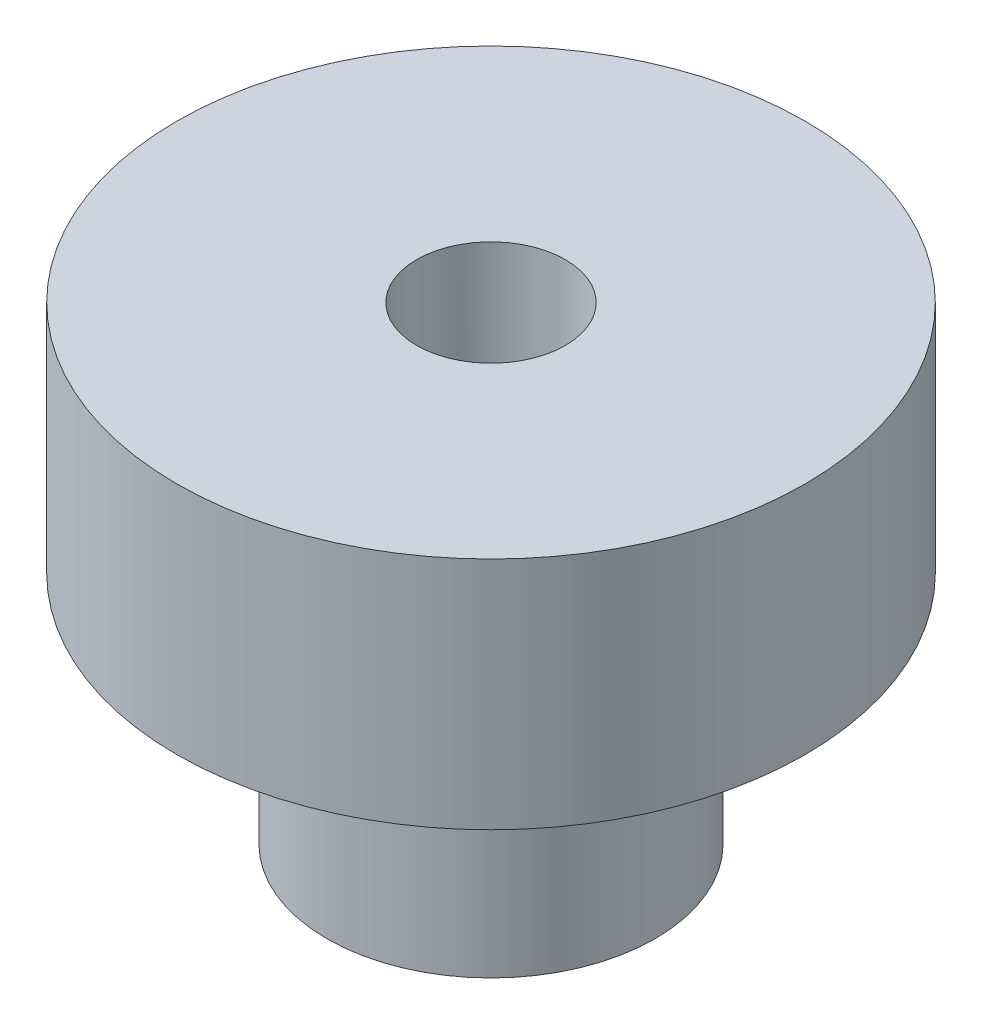
from build123d import *

# Parameters (mm, degrees)
SKETCH1_R           = 6.7
SKETCH1_R_2         = 1.586
BOSS_EXTRUDE1_DEPTH = 5
BOSS_EXTRUDE2_START = 5
SKETCH2_R           = 3.5
SKETCH2_R_2         = 1.586
BOSS_EXTRUDE2_DEPTH = 5
SKETCH3_R           = 1.25
CUT_EXTRUDE1_DEPTH  = 10


with BuildPart() as part:
    # Sketch1 → Boss-Extrude1 (new body)
    with BuildSketch(Plane(origin=(0, 0, 0), x_dir=(1, 0, 0), z_dir=(0, 1, 0))):
        Circle(SKETCH1_R)
        Circle(SKETCH1_R_2, mode=Mode.SUBTRACT)
    extrude(amount=BOSS_EXTRUDE1_DEPTH)

    # Sketch2 → Boss-Extrude2 (add)
    with BuildSketch(Plane.XZ.offset(BOSS_EXTRUDE2_START)):
        Circle(SKETCH2_R)
        Circle(SKETCH2_R_2, mode=Mode.SUBTRACT)
    extrude(amount=-BOSS_EXTRUDE2_DEPTH)

    # Sketch3 → Cut-Extrude1 (cut)
    with BuildSketch(Plane(origin=(0, 0, 0), x_dir=(0, 0, -1), z_dir=(1, 0, 0))):
        with Locations((0, -2.5)):
            Circle(SKETCH3_R)
    extrude(amount=-CUT_EXTRUDE1_DEPTH, mode=Mode.SUBTRACT)


solid = part.part
